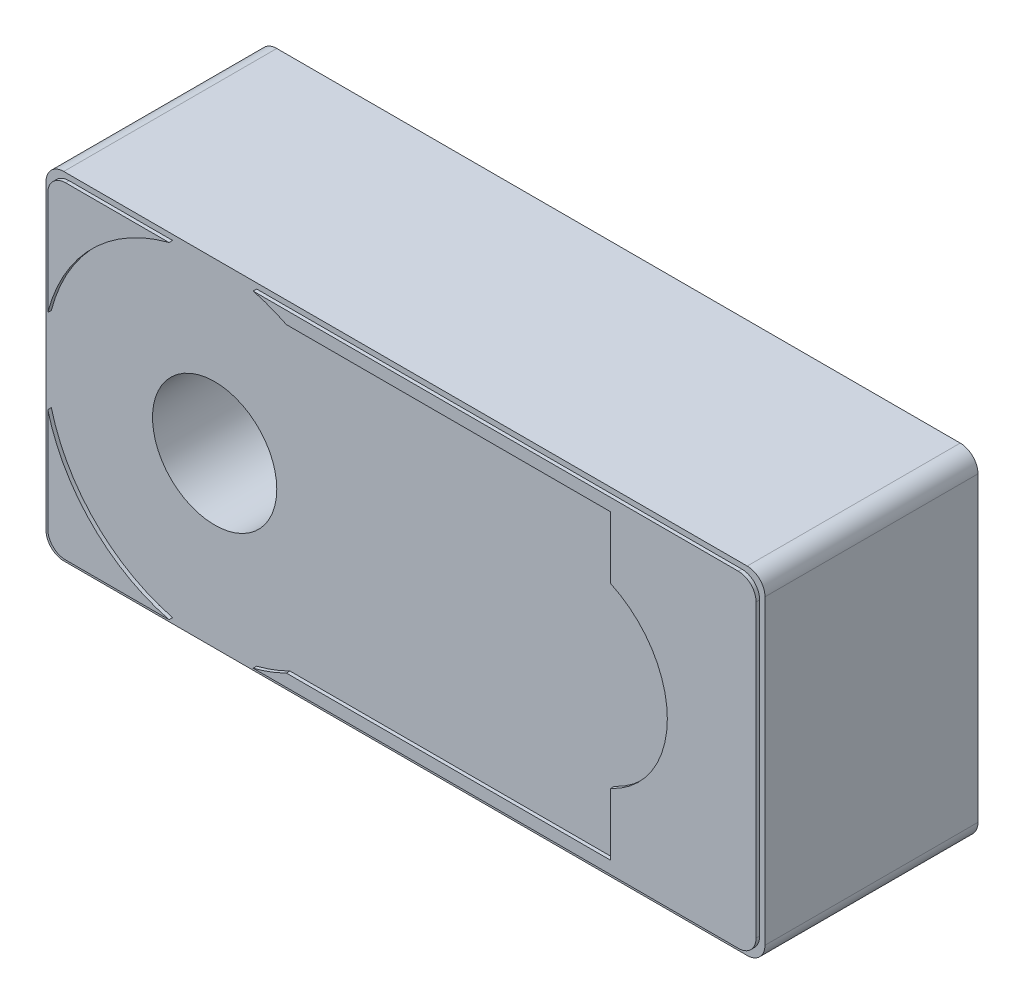
from build123d import *

# Parameters (mm, degrees)
CROQUIS1_R              = 3.5
CROQUIS1_R_2            = 0.8
SALIENTE_EXTRUIR1_DEPTH = 12
SALIENTE_EXTRUIR2_DEPTH = 0.2
VACIADO6_OUTLINE_R      = 4.5
VACIADO6_DEPTH          = 11
VACIADO6_START          = 11
VACIADO6_2_DEPTH        = 0.2


# Read off the part's stored shape, not the designer's step: Vaciado6
with BuildPart() as part:
    # Croquis1 → Saliente-Extruir1 (new body)
    with BuildSketch(Plane.XY):
        with BuildLine():
            Line((-9.5, 8.5), (-9.5, -8.5))
            ThreePointArc((-9.5, -8.5), (-9.207106781, -9.207106781), (-8.5, -9.5))
            Line((-8.5, -9.5), (30, -9.5))
            ThreePointArc((30, -9.5), (30.707106781, -9.207106781), (31, -8.5))
            Line((31, -8.5), (31, 8.5))
            ThreePointArc((31, 8.5), (30.707106781, 9.207106781), (30, 9.5))
            Line((30, 9.5), (-8.5, 9.5))
            ThreePointArc((-8.5, 9.5), (-9.207106781, 9.207106781), (-9.5, 8.5))
        make_face()
        Circle(CROQUIS1_R, mode=Mode.SUBTRACT)
        with Locations((29.4, -7.9)):
            Circle(CROQUIS1_R_2, mode=Mode.SUBTRACT)
        with Locations((-7.9, -7.9)):
            Circle(CROQUIS1_R_2, mode=Mode.SUBTRACT)
        with Locations((-7.9, 7.9)):
            Circle(CROQUIS1_R_2, mode=Mode.SUBTRACT)
        with Locations((29.4, 7.9)):
            Circle(CROQUIS1_R_2, mode=Mode.SUBTRACT)
    extrude(amount=SALIENTE_EXTRUIR1_DEPTH)

    # Croquis2 → Saliente-Extruir2 (add)
    with BuildSketch(Plane.XY.offset(12)):
        with BuildLine():
            Line((2.368543856, -9.2), (29.7, -9.2))
            ThreePointArc((29.7, -9.2), (30.407106781, -8.907106781), (30.7, -8.2))
            Line((30.7, -8.2), (30.7, 8.2))
            ThreePointArc((30.7, 8.2), (30.407106781, 8.907106781), (29.7, 9.2))
            Line((29.7, 9.2), (2.368543856, 9.2))
            ThreePointArc((2.368543856, 9.2), (3.324069835, 8.899469632), (4.242640687, 8.5))
            Line((4.242640687, 8.5), (22.5, 8.5))
            Line((22.5, 8.5), (22.5, 5))
            ThreePointArc((22.5, 5), (25.7, 0), (22.5, -5))
            Line((22.5, -5), (22.5, -8.5))
            Line((22.5, -8.5), (4.242640687, -8.5))
            ThreePointArc((4.242640687, -8.5), (3.324069835, -8.899469632), (2.368543856, -9.2))
        make_face()
        with BuildLine():
            Line((-8.2, -9.2), (-2.368543856, -9.2))
            ThreePointArc((-2.368543856, -9.2), (-6.717514421, -6.717514421), (-9.2, -2.368543856))
            Line((-9.2, -2.368543856), (-9.2, -8.2))
            ThreePointArc((-9.2, -8.2), (-8.907106781, -8.907106781), (-8.2, -9.2))
        make_face()
        with BuildLine():
            Line((-9.2, 8.2), (-9.2, 2.368543856))
            ThreePointArc((-9.2, 2.368543856), (-6.717514421, 6.717514421), (-2.368543856, 9.2))
            Line((-2.368543856, 9.2), (-8.2, 9.2))
            ThreePointArc((-8.2, 9.2), (-8.907106781, 8.907106781), (-9.2, 8.2))
        make_face()
    extrude(amount=SALIENTE_EXTRUIR2_DEPTH)

    # Vaciado6 outline → Vaciado6 (cut)
    with BuildSketch(Plane.XY):
        with BuildLine():
            Line((27.702943725, 8.5), (-6.202943725, 8.5))
            ThreePointArc((-6.202943725, 8.5), (-6.627207794, 6.627207794), (-8.5, 6.202943725))
            Line((-8.5, 6.202943725), (-8.5, -6.202943725))
            ThreePointArc((-8.5, -6.202943725), (-6.627207794, -6.627207794), (-6.202943725, -8.5))
            Line((-6.202943725, -8.5), (27.702943725, -8.5))
            ThreePointArc((27.702943725, -8.5), (28.127207794, -6.627207794), (30, -6.202943725))
            Line((30, -6.202943725), (30, 6.202943725))
            ThreePointArc((30, 6.202943725), (28.127207794, 6.627207794), (27.702943725, 8.5))
        make_face()
        Circle(VACIADO6_OUTLINE_R, mode=Mode.SUBTRACT)
    extrude(amount=VACIADO6_DEPTH, mode=Mode.SUBTRACT)

    # Vaciado6 2 outline → Vaciado6 2 (cut)
    with BuildSketch(Plane.XY.offset(VACIADO6_START)):
        with BuildLine():
            ThreePointArc((29.7, 6.125176065), (28.127207794, 6.627207794), (27.625176065, 8.2))
            Line((27.625176065, 8.2), (23.5, 8.2))
            Line((23.5, 8.2), (23.5, 5.60357029))
            ThreePointArc((23.5, 5.60357029), (26.7, 0), (23.5, -5.60357029))
            Line((23.5, -5.60357029), (23.5, -8.2))
            Line((23.5, -8.2), (27.625176065, -8.2))
            ThreePointArc((27.625176065, -8.2), (28.127207794, -6.627207794), (29.7, -6.125176065))
            Line((29.7, -6.125176065), (29.7, 6.125176065))
        make_face()
    extrude(amount=VACIADO6_2_DEPTH, mode=Mode.SUBTRACT)


solid = part.part
